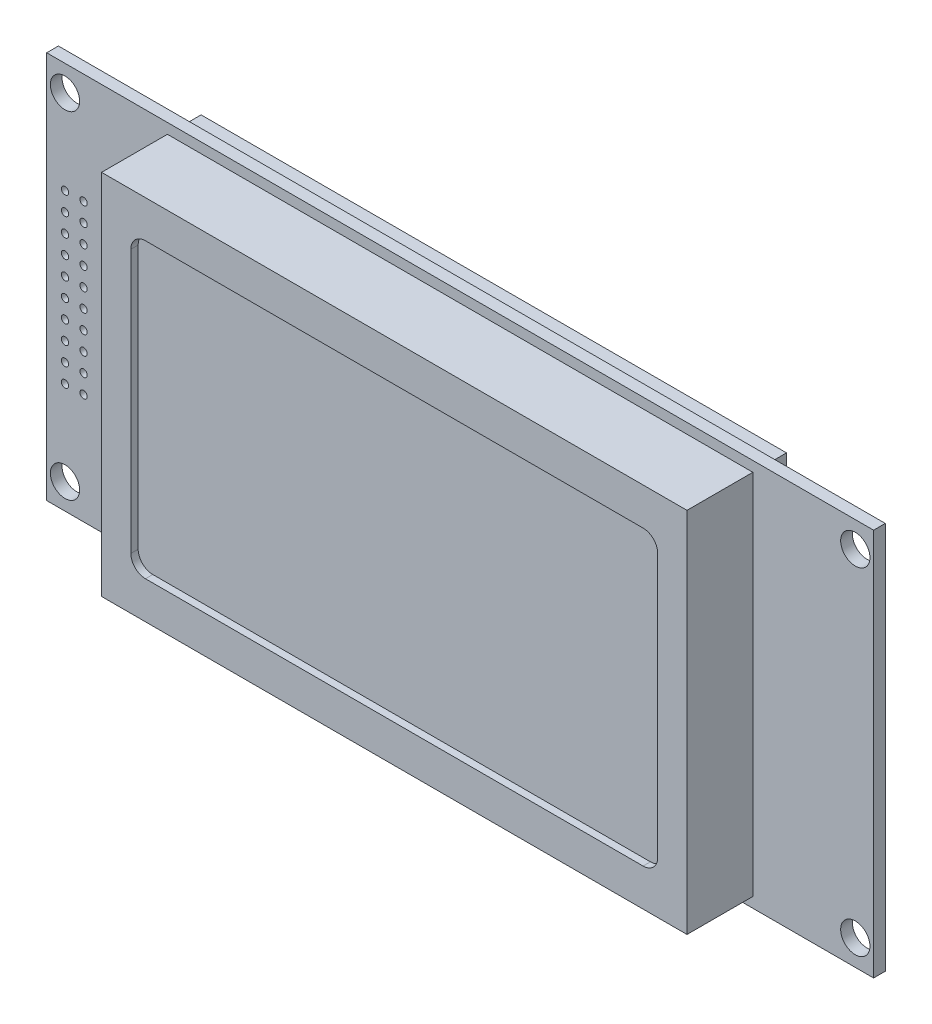
from build123d import *

# Parameters (mm, degrees)
ESQUISSE1_W             = 113
ESQUISSE1_H             = 53
ESQUISSE1_R             = 2
ESQUISSE1_R_2           = 0.5
BOSS_EXTRU_1_DEPTH      = 1.6
ESQUISSE2_W             = 80
ESQUISSE2_H             = 50.2
BOSS_EXTRU_2_DEPTH      = 9
ENL_V_MAT_EXTRU_1_DEPTH = 1
ESQUISSE6_W             = 80
ESQUISSE6_H             = 2.428445289
ESQUISSE6_H_2           = 1.774946784
BOSS_EXTRU_3_DEPTH      = 3


with BuildPart() as part:
    # Esquisse1 → Boss.-Extru.1 (new body)
    with BuildSketch(Plane.XY):
        Rectangle(ESQUISSE1_W, ESQUISSE1_H)
        with Locations((-54, 23)):
            Circle(ESQUISSE1_R, mode=Mode.SUBTRACT)
        with Locations((-54, -23)):
            Circle(ESQUISSE1_R, mode=Mode.SUBTRACT)
        with Locations((54, -23)):
            Circle(ESQUISSE1_R, mode=Mode.SUBTRACT)
        with Locations((54, 23)):
            Circle(ESQUISSE1_R, mode=Mode.SUBTRACT)
        with Locations((-54, 11.43)):
            Circle(ESQUISSE1_R_2, mode=Mode.SUBTRACT)
        with Locations((-51.46, 11.43)):
            Circle(ESQUISSE1_R_2, mode=Mode.SUBTRACT)
        with Locations((-51.46, 8.89)):
            Circle(ESQUISSE1_R_2, mode=Mode.SUBTRACT)
        with Locations((-51.46, 6.35)):
            Circle(ESQUISSE1_R_2, mode=Mode.SUBTRACT)
        with Locations((-51.46, 3.81)):
            Circle(ESQUISSE1_R_2, mode=Mode.SUBTRACT)
        with Locations((-51.46, 1.27)):
            Circle(ESQUISSE1_R_2, mode=Mode.SUBTRACT)
        with Locations((-51.46, -1.27)):
            Circle(ESQUISSE1_R_2, mode=Mode.SUBTRACT)
        with Locations((-51.46, -3.81)):
            Circle(ESQUISSE1_R_2, mode=Mode.SUBTRACT)
        with Locations((-51.46, -6.35)):
            Circle(ESQUISSE1_R_2, mode=Mode.SUBTRACT)
        with Locations((-51.46, -8.89)):
            Circle(ESQUISSE1_R_2, mode=Mode.SUBTRACT)
        with Locations((-51.46, -11.43)):
            Circle(ESQUISSE1_R_2, mode=Mode.SUBTRACT)
        with Locations((-54, 8.89)):
            Circle(ESQUISSE1_R_2, mode=Mode.SUBTRACT)
        with Locations((-54, 6.35)):
            Circle(ESQUISSE1_R_2, mode=Mode.SUBTRACT)
        with Locations((-54, 3.81)):
            Circle(ESQUISSE1_R_2, mode=Mode.SUBTRACT)
        with Locations((-54, 1.27)):
            Circle(ESQUISSE1_R_2, mode=Mode.SUBTRACT)
        with Locations((-54, -1.27)):
            Circle(ESQUISSE1_R_2, mode=Mode.SUBTRACT)
        with Locations((-54, -3.81)):
            Circle(ESQUISSE1_R_2, mode=Mode.SUBTRACT)
        with Locations((-54, -6.35)):
            Circle(ESQUISSE1_R_2, mode=Mode.SUBTRACT)
        with Locations((-54, -8.89)):
            Circle(ESQUISSE1_R_2, mode=Mode.SUBTRACT)
        with Locations((-54, -11.43)):
            Circle(ESQUISSE1_R_2, mode=Mode.SUBTRACT)
    extrude(amount=BOSS_EXTRU_1_DEPTH)

    # Esquisse2 → Boss.-Extru.2 (add)
    with BuildSketch(Plane.XY.offset(1.6)):
        Rectangle(ESQUISSE2_W, ESQUISSE2_H)
    extrude(amount=BOSS_EXTRU_2_DEPTH)

    # Esquisse4 → Enlèv. mat.-Extru.1 (cut)
    with BuildSketch(Plane.XY.offset(10.6)):
        with BuildLine():
            Line((34, -20), (-34, -20))
            ThreePointArc((-34, -20), (-35.414213562, -19.414213562), (-36, -18))
            Line((-36, -18), (-36, 18))
            ThreePointArc((-36, 18), (-35.414213562, 19.414213562), (-34, 20))
            Line((-34, 20), (34, 20))
            ThreePointArc((34, 20), (35.414213562, 19.414213562), (36, 18))
            Line((36, 18), (36, -18))
            ThreePointArc((36, -18), (35.414213562, -19.414213562), (34, -20))
        make_face()
    extrude(amount=-ENL_V_MAT_EXTRU_1_DEPTH, mode=Mode.SUBTRACT)

    # Esquisse6 → Boss.-Extru.3 (add)
    with BuildSketch(Plane(origin=(0, 0, 0), x_dir=(-1, 0, 0), z_dir=(0, 0, -1))):
        with Locations((0, 23.885777356)):
            Rectangle(ESQUISSE6_W, ESQUISSE6_H)
        with Locations((0, -24.212526608)):
            Rectangle(ESQUISSE6_W, ESQUISSE6_H_2)
    extrude(amount=BOSS_EXTRU_3_DEPTH)


solid = part.part
